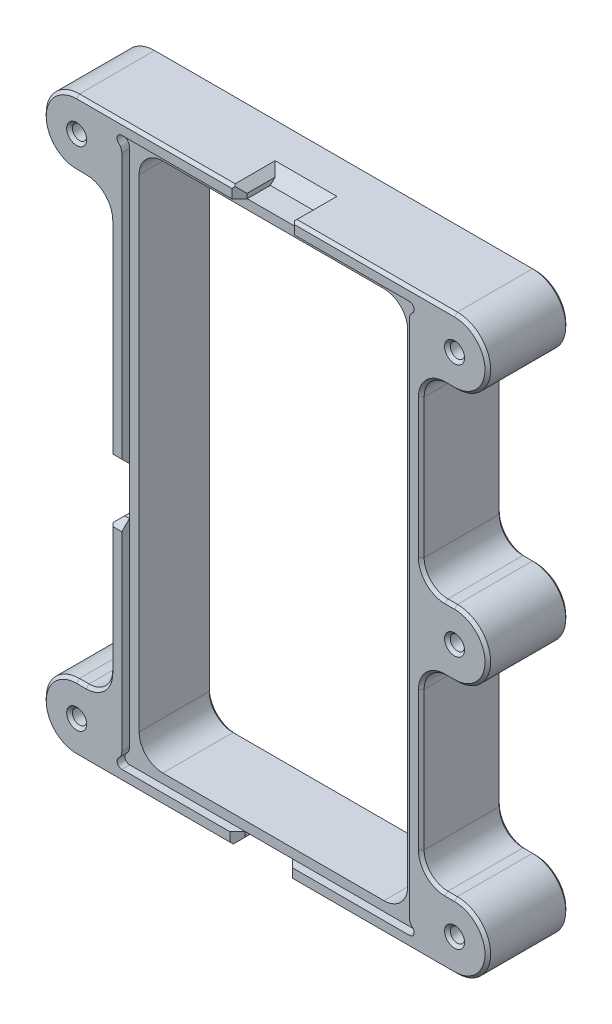
from build123d import *

# Parameters (mm, degrees)
SKETCH2_R           = 1.5
SKETCH2_W           = 60.5
SKETCH2_H           = 115.5
BOSS_EXTRUDE1_DEPTH = 17
SKETCH3_W           = 60.5
SKETCH3_H           = 115.5
SKETCH3_W_2         = 56.5
SKETCH3_H_2         = 111.5
BOSS_EXTRUDE2_DEPTH = 15.35972
FILLET1_R           = 5
FILLET2_R           = 5
SKETCH4_W           = 10
SKETCH4_H           = 2.5
SKETCH4_W_2         = 2.5
SKETCH4_H_2         = 10
CUT_EXTRUDE1_DEPTH  = 6.5
CHAMFER1_SIZE       = 1.6
CHAMFER2_SIZE       = 2.5
SKETCH5_R           = 1
CUT_EXTRUDE2_DEPTH  = 1.64028
FILLET3_R           = 2
CHAMFER3_SIZE       = 0.6
CHAMFER4_SIZE       = 0.6
CHAMFER5_SIZE       = 1.5
CHAMFER6_SIZE       = 0.6
CUT_EXTRUDE3_START  = -10
SKETCH6_R           = 1.5
CUT_EXTRUDE3_DEPTH  = 10
CHAMFER7_SIZE       = 2
CHAMFER8_SIZE       = 0.6


# Some blends are built 0.0001 mm under size
with BuildPart() as part:
    # Sketch2 → Boss-Extrude1 (new body)
    with BuildSketch(Plane.XY):
        with BuildLine():
            Line((69.75, -64.5), (62.75, -64.5))
            Line((62.75, -64.5), (62.75, -103.75))
            Line((62.75, -103.75), (69.75, -103.75))
            ThreePointArc((69.75, -103.75), (76.75, -110.75), (69.75, -117.75))
            Line((69.75, -117.75), (62.75, -117.75))
            Line((62.75, -117.75), (-2.75, -117.75))
            Line((-2.75, -117.75), (-9.75, -117.75))
            ThreePointArc((-9.75, -117.75), (-16.75, -110.75), (-9.75, -103.75))
            Line((-9.75, -103.75), (-2.75, -103.75))
            Line((-2.75, -103.75), (-2.75, -11.25))
            Line((-2.75, -11.25), (-9.75, -11.25))
            ThreePointArc((-9.75, -11.25), (-16.75, -4.25), (-9.75, 2.75))
            Line((-9.75, 2.75), (-2.75, 2.75))
            Line((-2.75, 2.75), (62.75, 2.75))
            Line((62.75, 2.75), (69.75, 2.75))
            ThreePointArc((69.75, 2.75), (76.75, -4.25), (69.75, -11.25))
            Line((69.75, -11.25), (62.75, -11.25))
            Line((62.75, -11.25), (62.75, -50.5))
            Line((62.75, -50.5), (69.75, -50.5))
            ThreePointArc((69.75, -50.5), (76.75, -57.5), (69.75, -64.5))
        make_face()
        with Locations((69.75, -57.5)):
            Circle(SKETCH2_R, mode=Mode.SUBTRACT)
        with Locations((69.75, -110.75)):
            Circle(SKETCH2_R, mode=Mode.SUBTRACT)
        with Locations((69.75, -4.25)):
            Circle(SKETCH2_R, mode=Mode.SUBTRACT)
        with Locations((-9.75, -110.75)):
            Circle(SKETCH2_R, mode=Mode.SUBTRACT)
        with Locations((-9.75, -4.25)):
            Circle(SKETCH2_R, mode=Mode.SUBTRACT)
        with Locations((30, -57.5)):
            Rectangle(SKETCH2_W, SKETCH2_H, mode=Mode.SUBTRACT)
    extrude(amount=-BOSS_EXTRUDE1_DEPTH)

    # Sketch3 → Boss-Extrude2 (add)
    with BuildSketch(Plane(origin=(0, 0, -17), x_dir=(-1, 0, 0), z_dir=(0, 0, -1))):
        with Locations((-30, -57.5)):
            Rectangle(SKETCH3_W, SKETCH3_H)
        with Locations((-30, -57.5)):
            Rectangle(SKETCH3_W_2, SKETCH3_H_2, mode=Mode.SUBTRACT)
    extrude(amount=-BOSS_EXTRUDE2_DEPTH)

    # Fillet1
    fillet1_edges = [part.edges().sort_by_distance(p)[0] for p in [
        (1.75, -1.75, -9.32014),
        (1.75, -113.25, -9.32014),
        (58.25, -113.25, -9.32014),
        (58.25, -1.75, -9.32014),
    ]]
    fillet(fillet1_edges, radius=FILLET1_R)

    # Fillet2
    fillet2_edges = [part.edges().sort_by_distance(p)[0] for p in [
        (62.75, -64.5, -8.5),
        (62.75, -103.75, -8.5),
        (-2.75, -103.75, -8.5),
        (-2.75, -11.25, -8.5),
        (62.75, -11.25, -8.5),
        (62.75, -50.5, -8.5),
    ]]
    fillet(fillet2_edges, radius=FILLET2_R)

    # Sketch4 → Cut-Extrude1 (cut)
    with BuildSketch(Plane.XY):
        with Locations((29.1, -116.5)):
            Rectangle(SKETCH4_W, SKETCH4_H)
        with Locations((-1.5, -65.362)):
            Rectangle(SKETCH4_W_2, SKETCH4_H_2)
        with Locations((29.5, 1.5)):
            Rectangle(SKETCH4_W, SKETCH4_H)
    extrude(amount=-CUT_EXTRUDE1_DEPTH, mode=Mode.SUBTRACT)

    # Chamfer1
    chamfer1_edges = [part.edges().sort_by_distance(p)[0] for p in [
        (34.1, -116.5, 0),
        (24.1, -116.5, 0),
        (-1.5, -60.362, 0),
        (-1.5, -70.362, 0),
        (24.5, 1.5, 0),
        (34.5, 1.5, 0),
    ]]
    chamfer(chamfer1_edges, length=CHAMFER1_SIZE)

    # Chamfer2
    chamfer2_edges = [part.edges().sort_by_distance(p)[0] for p in [
        (29.5, 2.75, -6.5),
        (-2.75, -65.362, -6.5),
        (29.1, -117.75, -6.5),
    ]]
    chamfer(chamfer2_edges, length=CHAMFER2_SIZE - 0.0001)  # a hair under: the kernel refuses the full size

    # Sketch5 → Cut-Extrude2 (cut)
    with BuildSketch(Plane.XY):
        with Locations((-0.25, -0.75)):
            Circle(SKETCH5_R)
        with Locations((-0.25, -114.25)):
            Circle(SKETCH5_R)
        with Locations((60.25, -114.25)):
            Circle(SKETCH5_R)
        with Locations((60.25, -0.75)):
            Circle(SKETCH5_R)
    extrude(amount=-CUT_EXTRUDE2_DEPTH, mode=Mode.SUBTRACT)

    # Fillet3
    fillet3_edges = [part.edges().sort_by_distance(p)[0] for p in [
        (-0.25, -1.75, -0.82014),
        (60.25, -1.75, -0.82014),
        (60.25, -113.25, -0.82014),
        (-0.25, -113.25, -0.82014),
    ]]
    fillet(fillet3_edges, radius=FILLET3_R)

    # Chamfer3
    chamfer3_edges = [part.edges().sort_by_distance(p)[0] for p in [
        (-8.75, -103.75, -17),
        (-16.75, -110.75, -17),
        (30, -117.75, -17),
        (76.75, -110.75, -17),
        (68.75, -103.75, -17),
        (62.75, -30.875, -17),
        (62.75, -84.125, -17),
        (-2.75, -57.5, -17),
        (64.214466094, -49.035533906, -17),
        (64.214466094, -65.964466094, -17),
        (64.214466094, -102.285533906, -17),
        (64.214466094, -12.714466094, -17),
        (-4.214466094, -12.714466094, -17),
        (-4.214466094, -102.285533906, -17),
        (68.75, -64.5, -17),
        (76.75, -57.5, -17),
        (68.75, -50.5, -17),
        (68.75, -11.25, -17),
        (76.75, -4.25, -17),
        (30, 2.75, -17),
        (-16.75, -4.25, -17),
        (-8.75, -11.25, -17),
    ]]
    chamfer(chamfer3_edges, length=CHAMFER3_SIZE)

    # Chamfer4
    chamfer4_edges = [part.edges().sort_by_distance(p)[0] for p in [
        (62.75, -30.875, 0),
        (62.75, -84.125, 0),
        (-2.75, -37.506, 0),
        (64.214466094, -49.035533906, 0),
        (64.214466094, -65.964466094, 0),
        (64.214466094, -102.285533906, 0),
        (64.214466094, -12.714466094, 0),
        (-4.214466094, -12.714466094, 0),
        (-4.214466094, -102.285533906, 0),
        (52.925, 2.75, 0),
        (-2.75, -85.356, 0),
        (6.375, -117.75, 0),
        (68.75, -103.75, 0),
        (76.75, -110.75, 0),
        (52.725, -117.75, 0),
        (-16.75, -110.75, 0),
        (-8.75, -103.75, 0),
        (-8.75, -11.25, 0),
        (-16.75, -4.25, 0),
        (6.575, 2.75, 0),
        (76.75, -4.25, 0),
        (68.75, -11.25, 0),
        (68.75, -50.5, 0),
        (76.75, -57.5, 0),
        (68.75, -64.5, 0),
    ]]
    chamfer(chamfer4_edges, length=CHAMFER4_SIZE)

    # Chamfer5
    chamfer5_edges = [part.edges().sort_by_distance(p)[0] for p in [
        (24.1, -117.75, -5.29995),
        (34.1, -117.75, -5.29995),
        (-2.75, -70.362, -5.29995),
        (-2.75, -60.362, -5.29995),
        (24.5, 2.75, -5.29995),
        (34.5, 2.75, -5.29995),
    ]]
    chamfer(chamfer5_edges, length=CHAMFER5_SIZE)

    # Chamfer6
    chamfer6_edges = [part.edges().sort_by_distance(p)[0] for p in [
        (30, -1.75, -17),
        (1.75, -57.5, -17),
        (58.25, -57.5, -17),
        (30, -113.25, -17),
        (3.214466094, -3.214466094, -17),
        (56.785533906, -3.214466094, -17),
        (3.214466094, -111.785533906, -17),
        (56.785533906, -111.785533906, -17),
    ]]
    chamfer(chamfer6_edges, length=CHAMFER6_SIZE)

    # Sketch6 → Cut-Extrude3 (cut)
    # profile 1 of 5: a face of its own
    with BuildSketch(Plane(origin=(0, 0, -17), x_dir=(-1, 0, 0), z_dir=(0, 0, -1)).offset(CUT_EXTRUDE3_START)):
        Polygon((11.482050808, -107.75), (8.017949192, -107.75), (6.285898385, -110.75), (8.017949192, -113.75), (11.482050808, -113.75), (13.214101615, -110.75), align=None)
        with Locations(Location((9.75, -110.75, 0), (0, 0, 180))):
            Circle(SKETCH6_R, mode=Mode.SUBTRACT)
    # profile 2 of 5: a face of its own
    with BuildSketch(Plane(origin=(0, 0, -17), x_dir=(-1, 0, 0), z_dir=(0, 0, -1)).offset(CUT_EXTRUDE3_START)):
        Polygon((-71.482050808, -113.75), (-68.017949192, -113.75), (-66.285898385, -110.75), (-68.017949192, -107.75), (-71.482050808, -107.75), (-73.214101615, -110.75), align=None)
        with Locations(Location((-69.75, -110.75, 0), (0, 0, 180))):
            Circle(SKETCH6_R, mode=Mode.SUBTRACT)
    # profile 3 of 5: a face of its own
    with BuildSketch(Plane(origin=(0, 0, -17), x_dir=(-1, 0, 0), z_dir=(0, 0, -1)).offset(CUT_EXTRUDE3_START)):
        Polygon((-71.482050808, -60.5), (-68.017949192, -60.5), (-66.285898385, -57.5), (-68.017949192, -54.5), (-71.482050808, -54.5), (-73.214101615, -57.5), align=None)
        with Locations(Location((-69.75, -57.5, 0), (0, 0, 180))):
            Circle(SKETCH6_R, mode=Mode.SUBTRACT)
    # profile 4 of 5: a face of its own
    with BuildSketch(Plane(origin=(0, 0, -17), x_dir=(-1, 0, 0), z_dir=(0, 0, -1)).offset(CUT_EXTRUDE3_START)):
        Polygon((-73.214101615, -4.25), (-71.482050808, -7.25), (-68.017949192, -7.25), (-66.285898385, -4.25), (-68.017949192, -1.25), (-71.482050808, -1.25), align=None)
        with Locations(Location((-69.75, -4.25, 0), (0, 0, 180))):
            Circle(SKETCH6_R, mode=Mode.SUBTRACT)
    # profile 5 of 5: a face of its own
    with BuildSketch(Plane(origin=(0, 0, -17), x_dir=(-1, 0, 0), z_dir=(0, 0, -1)).offset(CUT_EXTRUDE3_START)):
        Polygon((11.482050808, -1.25), (8.017949192, -1.25), (6.285898385, -4.25), (8.017949192, -7.25), (11.482050808, -7.25), (13.214101615, -4.25), align=None)
        with Locations(Location((9.75, -4.25, 0), (0, 0, 180))):
            Circle(SKETCH6_R, mode=Mode.SUBTRACT)
    extrude(amount=CUT_EXTRUDE3_DEPTH, mode=Mode.SUBTRACT)

    # Chamfer7
    # the kernel refuses this chamfer: 2 mm, written as the material it takes off along each edge
    with BuildSketch(Plane(origin=(-9.75, -4.25, -7), x_dir=(1, 0, 0), z_dir=(0, 1, 0))) as chamfer7_piece_1_section:
        Polygon((1.5 + CHAMFER7_SIZE, 0), (1.5, -CHAMFER7_SIZE), (1.5, 0), align=None)
    chamfer7_piece_1 = revolve(axis=Axis((-9.75, -4.25, -7), (0, 0, -1)), mode=Mode.PRIVATE)
    chamfer7_piece_1 = split(chamfer7_piece_1, bisect_by=Plane(origin=(-12.182353268, -1.25, -5.975179805), z_dir=(0, -1, 0)), keep=Keep.TOP, mode=Mode.PRIVATE)
    chamfer7_piece_1 = split(chamfer7_piece_1, bisect_by=Plane(origin=(-7.760012106, -1.696760139, -5.975179805), z_dir=(-0.8660254037844387, -0.5000000000000001, 0)), keep=Keep.TOP, mode=Mode.PRIVATE)
    chamfer7_piece_1 = split(chamfer7_piece_1, bisect_by=Plane(origin=(-7.760012106, -6.803239861, -5.975179805), z_dir=(-0.8660254037844387, 0.49999999999999994, 0)), keep=Keep.TOP, mode=Mode.PRIVATE)
    chamfer7_piece_1 = split(chamfer7_piece_1, bisect_by=Plane(origin=(-12.182353268, -7.25, -5.975179805), z_dir=(0, 1, 0)), keep=Keep.TOP, mode=Mode.PRIVATE)
    chamfer7_piece_1 = split(chamfer7_piece_1, bisect_by=Plane(origin=(-12.956164528, -4.696760139, -5.975179805), z_dir=(0.8660254037844389, 0.49999999999999956, 0)), keep=Keep.TOP, mode=Mode.PRIVATE)
    chamfer7_piece_1 = split(chamfer7_piece_1, bisect_by=Plane(origin=(-12.956164528, -3.803239861, -5.975179805), z_dir=(0.8660254037844388, -0.4999999999999998, 0)), keep=Keep.TOP, mode=Mode.PRIVATE)
    add(chamfer7_piece_1, mode=Mode.SUBTRACT)
    with BuildSketch(Plane(origin=(69.75, -4.25, -7), x_dir=(1, 0, 0), z_dir=(0, 1, 0))) as chamfer7_piece_2_section:
        Polygon((1.5 + CHAMFER7_SIZE, 0), (1.5, -CHAMFER7_SIZE), (1.5, 0), align=None)
    chamfer7_piece_2 = revolve(axis=Axis((69.75, -4.25, -7), (0, 0, -1)), mode=Mode.PRIVATE)
    chamfer7_piece_2 = split(chamfer7_piece_2, bisect_by=Plane(origin=(71.739987894, -6.803239861, -5.975179805), z_dir=(-0.86602540378444, 0.4999999999999977, 0)), keep=Keep.TOP, mode=Mode.PRIVATE)
    chamfer7_piece_2 = split(chamfer7_piece_2, bisect_by=Plane(origin=(67.317646732, -7.25, -5.975179805), z_dir=(0, 1, 0)), keep=Keep.TOP, mode=Mode.PRIVATE)
    chamfer7_piece_2 = split(chamfer7_piece_2, bisect_by=Plane(origin=(66.543835472, -4.696760139, -5.975179805), z_dir=(0.8660254037844383, 0.5000000000000007, 0)), keep=Keep.TOP, mode=Mode.PRIVATE)
    chamfer7_piece_2 = split(chamfer7_piece_2, bisect_by=Plane(origin=(66.543835472, -3.803239861, -5.975179805), z_dir=(0.8660254037844383, -0.5000000000000009, 0)), keep=Keep.TOP, mode=Mode.PRIVATE)
    chamfer7_piece_2 = split(chamfer7_piece_2, bisect_by=Plane(origin=(67.317646732, -1.25, -5.975179805), z_dir=(0, -1, 0)), keep=Keep.TOP, mode=Mode.PRIVATE)
    chamfer7_piece_2 = split(chamfer7_piece_2, bisect_by=Plane(origin=(71.739987894, -1.696760139, -5.975179805), z_dir=(-0.86602540378444, -0.4999999999999975, 0)), keep=Keep.TOP, mode=Mode.PRIVATE)
    add(chamfer7_piece_2, mode=Mode.SUBTRACT)
    with BuildSketch(Plane(origin=(69.75, -57.5, -7), x_dir=(1, 0, 0), z_dir=(0, 1, 0))) as chamfer7_piece_3_section:
        Polygon((1.5 + CHAMFER7_SIZE, 0), (1.5, -CHAMFER7_SIZE), (1.5, 0), align=None)
    chamfer7_piece_3 = revolve(axis=Axis((69.75, -57.5, -7), (0, 0, -1)), mode=Mode.PRIVATE)
    chamfer7_piece_3 = split(chamfer7_piece_3, bisect_by=Plane(origin=(67.317646732, -60.5, -5.975179805), z_dir=(0, 1, 0)), keep=Keep.TOP, mode=Mode.PRIVATE)
    chamfer7_piece_3 = split(chamfer7_piece_3, bisect_by=Plane(origin=(66.543835472, -57.946760139, -5.975179805), z_dir=(0.8660254037844398, 0.49999999999999795, 0)), keep=Keep.TOP, mode=Mode.PRIVATE)
    chamfer7_piece_3 = split(chamfer7_piece_3, bisect_by=Plane(origin=(66.543835472, -57.053239861, -5.975179805), z_dir=(0.866025403784439, -0.4999999999999993, 0)), keep=Keep.TOP, mode=Mode.PRIVATE)
    chamfer7_piece_3 = split(chamfer7_piece_3, bisect_by=Plane(origin=(67.317646732, -54.5, -5.975179805), z_dir=(0, -1, 0)), keep=Keep.TOP, mode=Mode.PRIVATE)
    chamfer7_piece_3 = split(chamfer7_piece_3, bisect_by=Plane(origin=(71.739987894, -54.946760139, -5.975179805), z_dir=(-0.8660254037844383, -0.5000000000000007, 0)), keep=Keep.TOP, mode=Mode.PRIVATE)
    chamfer7_piece_3 = split(chamfer7_piece_3, bisect_by=Plane(origin=(71.739987894, -60.053239861, -5.975179805), z_dir=(-0.8660254037844388, 0.4999999999999997, 0)), keep=Keep.TOP, mode=Mode.PRIVATE)
    add(chamfer7_piece_3, mode=Mode.SUBTRACT)
    with BuildSketch(Plane(origin=(-9.75, -110.75, -7), x_dir=(1, 0, 0), z_dir=(0, 1, 0))) as chamfer7_piece_4_section:
        Polygon((1.5 + CHAMFER7_SIZE, 0), (1.5, -CHAMFER7_SIZE), (1.5, 0), align=None)
    chamfer7_piece_4 = revolve(axis=Axis((-9.75, -110.75, -7), (0, 0, -1)), mode=Mode.PRIVATE)
    chamfer7_piece_4 = split(chamfer7_piece_4, bisect_by=Plane(origin=(-12.182353268, -107.75, -5.975179805), z_dir=(0, -1, 0)), keep=Keep.TOP, mode=Mode.PRIVATE)
    chamfer7_piece_4 = split(chamfer7_piece_4, bisect_by=Plane(origin=(-7.760012106, -108.196760139, -5.975179805), z_dir=(-0.8660254037844387, -0.4999999999999999, 0)), keep=Keep.TOP, mode=Mode.PRIVATE)
    chamfer7_piece_4 = split(chamfer7_piece_4, bisect_by=Plane(origin=(-7.760012106, -113.303239861, -5.975179805), z_dir=(-0.8660254037844384, 0.5000000000000006, 0)), keep=Keep.TOP, mode=Mode.PRIVATE)
    chamfer7_piece_4 = split(chamfer7_piece_4, bisect_by=Plane(origin=(-12.182353268, -113.75, -5.975179805), z_dir=(0, 1, 0)), keep=Keep.TOP, mode=Mode.PRIVATE)
    chamfer7_piece_4 = split(chamfer7_piece_4, bisect_by=Plane(origin=(-12.956164528, -111.196760139, -5.975179805), z_dir=(0.8660254037844389, 0.4999999999999995, 0)), keep=Keep.TOP, mode=Mode.PRIVATE)
    chamfer7_piece_4 = split(chamfer7_piece_4, bisect_by=Plane(origin=(-12.956164528, -110.303239861, -5.975179805), z_dir=(0.8660254037844375, -0.500000000000002, 0)), keep=Keep.TOP, mode=Mode.PRIVATE)
    add(chamfer7_piece_4, mode=Mode.SUBTRACT)
    with BuildSketch(Plane(origin=(69.75, -110.75, -7), x_dir=(1, 0, 0), z_dir=(0, 1, 0))) as chamfer7_piece_5_section:
        Polygon((1.5 + CHAMFER7_SIZE, 0), (1.5, -CHAMFER7_SIZE), (1.5, 0), align=None)
    chamfer7_piece_5 = revolve(axis=Axis((69.75, -110.75, -7), (0, 0, -1)), mode=Mode.PRIVATE)
    chamfer7_piece_5 = split(chamfer7_piece_5, bisect_by=Plane(origin=(67.317646732, -113.75, -5.975179805), z_dir=(0, 1, 0)), keep=Keep.TOP, mode=Mode.PRIVATE)
    chamfer7_piece_5 = split(chamfer7_piece_5, bisect_by=Plane(origin=(66.543835472, -111.196760139, -5.975179805), z_dir=(0.8660254037844388, 0.4999999999999997, 0)), keep=Keep.TOP, mode=Mode.PRIVATE)
    chamfer7_piece_5 = split(chamfer7_piece_5, bisect_by=Plane(origin=(66.543835472, -110.303239861, -5.975179805), z_dir=(0.8660254037844393, -0.4999999999999989, 0)), keep=Keep.TOP, mode=Mode.PRIVATE)
    chamfer7_piece_5 = split(chamfer7_piece_5, bisect_by=Plane(origin=(67.317646732, -107.75, -5.975179805), z_dir=(0, -1, 0)), keep=Keep.TOP, mode=Mode.PRIVATE)
    chamfer7_piece_5 = split(chamfer7_piece_5, bisect_by=Plane(origin=(71.739987894, -108.196760139, -5.975179805), z_dir=(-0.8660254037844396, -0.49999999999999845, 0)), keep=Keep.TOP, mode=Mode.PRIVATE)
    chamfer7_piece_5 = split(chamfer7_piece_5, bisect_by=Plane(origin=(71.739987894, -113.303239861, -5.975179805), z_dir=(-0.8660254037844404, 0.49999999999999717, 0)), keep=Keep.TOP, mode=Mode.PRIVATE)
    add(chamfer7_piece_5, mode=Mode.SUBTRACT)

    # Chamfer8
    chamfer8_edges = [part.edges().sort_by_distance(p)[0] for p in [
        (-11.25, -4.25, 0),
        (-11.25, -110.75, 0),
        (68.25, -4.25, 0),
        (68.25, -110.75, 0),
        (68.25, -57.5, 0),
    ]]
    chamfer(chamfer8_edges, length=CHAMFER8_SIZE)


solid = part.part
